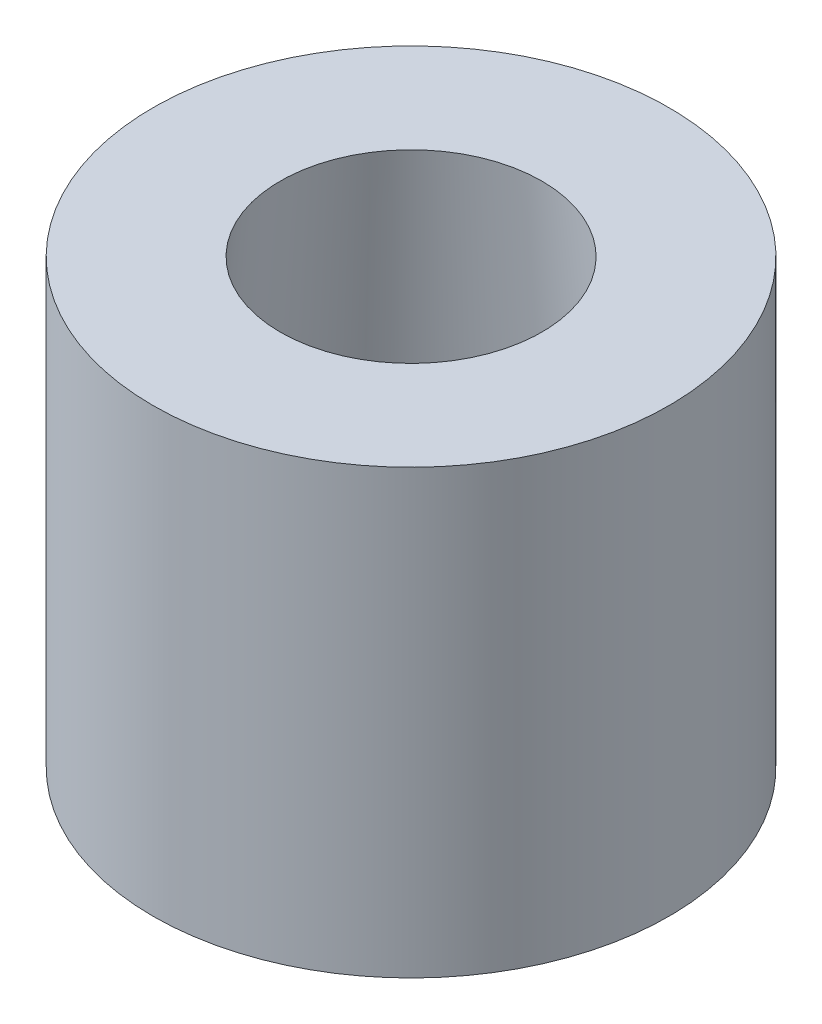
from build123d import *

# Parameters (mm, degrees)
SKETCH2_R           = 17.5
BOSS_EXTRUDE2_DEPTH = 30
SKETCH3_R           = 11.5
CUT_EXTRUDE1_DEPTH  = 30
CUT_EXTRUDE1_DRAFT  = -5
SKETCH4_R           = 15.5
SKETCH4_R_2         = 12
CUT_EXTRUDE2_DEPTH  = 5


with BuildPart() as part:
    # Sketch2 → Boss-Extrude2 (new body)
    with BuildSketch(Plane(origin=(0, 0, 0), x_dir=(1, 0, 0), z_dir=(0, 1, 0))):
        Circle(SKETCH2_R)
    extrude(amount=BOSS_EXTRUDE2_DEPTH)


with BuildPart() as cut_extrude1_tool:
    # Sketch3 → Cut-Extrude1 (with draft: the straight prism first)
    with BuildSketch(Plane.XZ):
        Circle(SKETCH3_R)
    extrude(amount=-CUT_EXTRUDE1_DEPTH)
    # Cut-Extrude1: the draft: its side faces are tilted about the plane it starts from
    cut_extrude1_sides = [cut_extrude1_tool.faces().sort_by_distance(p)[0] for p in [
        (-11.5, 15, 0),
    ]]
    draft(cut_extrude1_sides, Plane.XZ, CUT_EXTRUDE1_DRAFT)


with BuildPart() as part_1:
    add(part.part)

    # Cut-Extrude1: cut by cut_extrude1_tool
    add(cut_extrude1_tool.part, mode=Mode.SUBTRACT)

    # Sketch4 → Cut-Extrude2 (cut)
    with BuildSketch(Plane.XZ):
        Circle(SKETCH4_R)
        Circle(SKETCH4_R_2, mode=Mode.SUBTRACT)
    extrude(amount=-CUT_EXTRUDE2_DEPTH, mode=Mode.SUBTRACT)


solid = part_1.part
